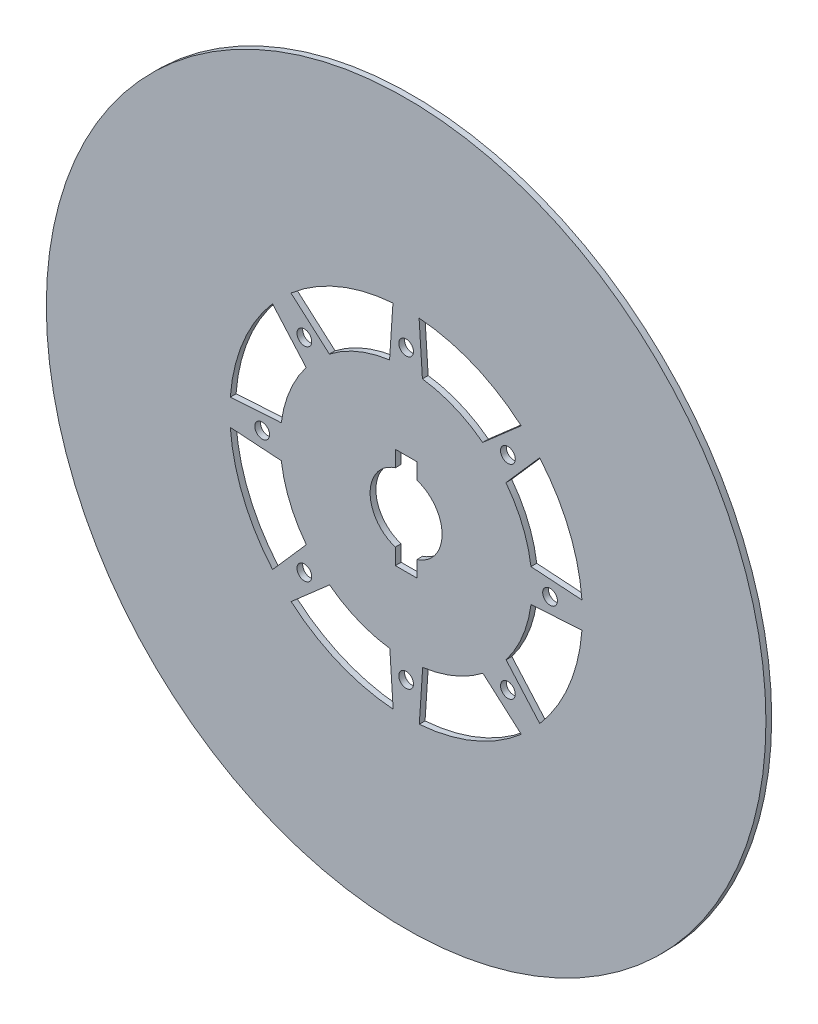
from build123d import *

# Parameters (mm, degrees)
BOSS_EXTRUDE1_OUTLINE_R = 50
BOSS_EXTRUDE1_DEPTH     = 0.8
SKETCH2_R               = 1.025
CUT_EXTRUDE5_DEPTH      = 10


# Read off the part's stored shape, not the designer's step: Boss-Extrude1
with BuildPart() as part:
    # Boss-Extrude1 outline → Boss-Extrude1 (new body)
    with BuildSketch(Plane.XY):
        Circle(BOSS_EXTRUDE1_OUTLINE_R)
        with BuildLine():
            ThreePointArc((-10.640683383, -13.893374577), (-6.680080661, -16.174873179), (-2.263779528, -17.352962348))
            Line((-2.263779528, -17.352962348), (-1.802339331, -24.433615634))
            ThreePointArc((-1.802339331, -24.433615634), (-9.36241701, -22.64056421), (-15.980874836, -18.570450707))
            Line((-15.980874836, -18.570450707), (-10.640683383, -13.893374577))
        make_face(mode=Mode.SUBTRACT)
        with BuildLine():
            ThreePointArc((-17.348198754, -2.3), (-16.160892844, -6.713832175), (-13.871131205, -10.669663495))
            Line((-13.871131205, -10.669663495), (-18.551621667, -16.00272894))
            ThreePointArc((-18.551621667, -16.00272894), (-22.629525039, -9.389067926), (-24.431476591, -1.831106659))
            Line((-24.431476591, -1.831106659), (-17.348198754, -2.3))
        make_face(mode=Mode.SUBTRACT)
        with BuildLine():
            ThreePointArc((2.3, -17.348198754), (6.713832175, -16.160892844), (10.669663495, -13.871131205))
            Line((10.669663495, -13.871131205), (16.00272894, -18.551621667))
            ThreePointArc((16.00272894, -18.551621667), (9.389067926, -22.629525039), (1.831106659, -24.431476591))
            Line((1.831106659, -24.431476591), (2.3, -17.348198754))
        make_face(mode=Mode.SUBTRACT)
        with BuildLine():
            ThreePointArc((13.893374577, -10.640683383), (16.174873179, -6.680080661), (17.352962348, -2.263779528))
            Line((17.352962348, -2.263779528), (24.433615634, -1.802339331))
            ThreePointArc((24.433615634, -1.802339331), (22.64056421, -9.36241701), (18.570450707, -15.980874836))
            Line((18.570450707, -15.980874836), (13.893374577, -10.640683383))
        make_face(mode=Mode.SUBTRACT)
        with BuildLine():
            ThreePointArc((-13.893374577, 10.640683383), (-16.174873179, 6.680080661), (-17.352962348, 2.263779528))
            Line((-17.352962348, 2.263779528), (-24.433615634, 1.802339331))
            ThreePointArc((-24.433615634, 1.802339331), (-22.64056421, 9.36241701), (-18.570450707, 15.980874836))
            Line((-18.570450707, 15.980874836), (-13.893374577, 10.640683383))
        make_face(mode=Mode.SUBTRACT)
        with BuildLine():
            ThreePointArc((-2.3, 17.348198754), (-6.713832175, 16.160892844), (-10.669663495, 13.871131205))
            Line((-10.669663495, 13.871131205), (-16.00272894, 18.551621667))
            ThreePointArc((-16.00272894, 18.551621667), (-9.389067926, 22.629525039), (-1.831106659, 24.431476591))
            Line((-1.831106659, 24.431476591), (-2.3, 17.348198754))
        make_face(mode=Mode.SUBTRACT)
        with BuildLine():
            ThreePointArc((-1.5, -4.769696007), (-5, 0), (-1.5, 4.769696007))
            Line((-1.5, 4.769696007), (-1.5, 7))
            Line((-1.5, 7), (1.5, 7))
            Line((1.5, 7), (1.5, 4.769696007))
            ThreePointArc((1.5, 4.769696007), (5, 0), (1.5, -4.769696007))
            Line((1.5, -4.769696007), (1.5, -7))
            Line((1.5, -7), (-1.5, -7))
            Line((-1.5, -7), (-1.5, -4.769696007))
        make_face(mode=Mode.SUBTRACT)
        with BuildLine():
            ThreePointArc((17.348198754, 2.3), (16.160892844, 6.713832175), (13.871131205, 10.669663495))
            Line((13.871131205, 10.669663495), (18.551621667, 16.00272894))
            ThreePointArc((18.551621667, 16.00272894), (22.629525039, 9.389067926), (24.431476591, 1.831106659))
            Line((24.431476591, 1.831106659), (17.348198754, 2.3))
        make_face(mode=Mode.SUBTRACT)
        with BuildLine():
            ThreePointArc((10.640683383, 13.893374577), (6.680080661, 16.174873179), (2.263779528, 17.352962348))
            Line((2.263779528, 17.352962348), (1.802339331, 24.433615634))
            ThreePointArc((1.802339331, 24.433615634), (9.36241701, 22.64056421), (15.980874836, 18.570450707))
            Line((15.980874836, 18.570450707), (10.640683383, 13.893374577))
        make_face(mode=Mode.SUBTRACT)
    extrude(amount=BOSS_EXTRUDE1_DEPTH)

    # Sketch2 → Cut-Extrude5 (cut)
    with BuildSketch(Plane.XY):
        with Locations((0, 20)):
            Circle(SKETCH2_R)
        with Locations((14.142135624, 14.142135624)):
            Circle(SKETCH2_R)
        with Locations((20, 0)):
            Circle(SKETCH2_R)
        with Locations((14.142135624, -14.142135624)):
            Circle(SKETCH2_R)
        with Locations((0, -20)):
            Circle(SKETCH2_R)
        with Locations((-14.142135624, -14.142135624)):
            Circle(SKETCH2_R)
        with Locations((-20, 0)):
            Circle(SKETCH2_R)
        with Locations((-14.142135624, 14.142135624)):
            Circle(SKETCH2_R)
    extrude(amount=CUT_EXTRUDE5_DEPTH, mode=Mode.SUBTRACT)


solid = part.part
